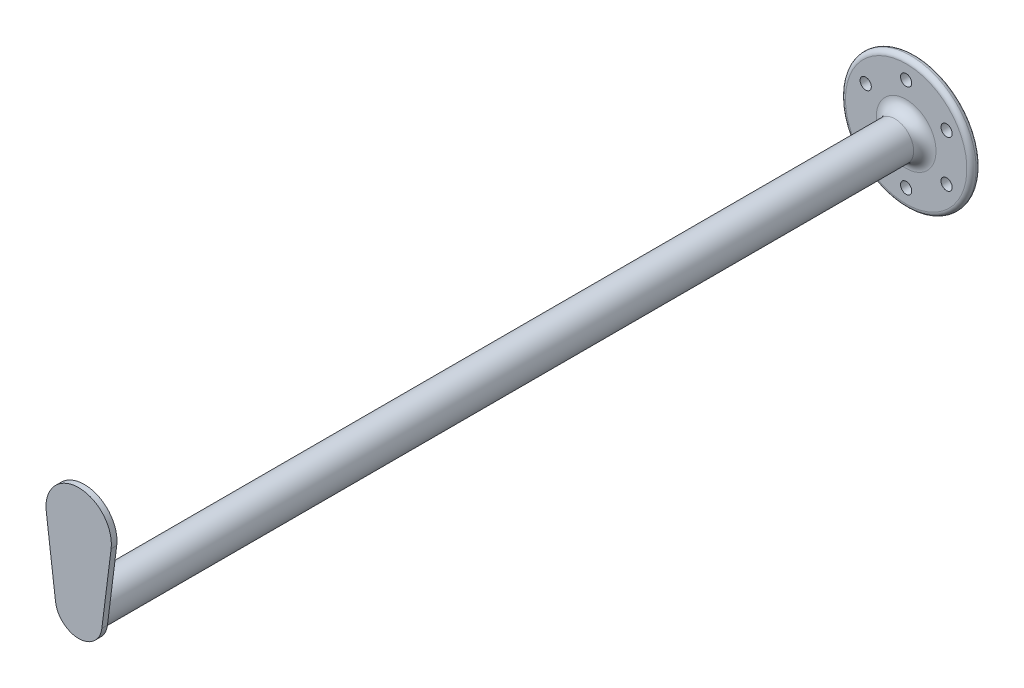
from build123d import *

# Parameters (mm, degrees)
SKETCH2_R           = 12.7
BOSS_EXTRUDE1_DEPTH = 558.8
SKETCH3_R           = 44.45
SKETCH3_R_2         = 3.81
BOSS_EXTRUDE2_DEPTH = 6.35
FILLET1_R           = 7.62
FILLET2_R           = 3.175
BOSS_EXTRUDE3_DEPTH = 3.81
FILLET3_R           = 1.27


with BuildPart() as part:
    # Sketch2 → Boss-Extrude1 (new body)
    with BuildSketch(Plane.XY):
        Circle(SKETCH2_R)
    extrude(amount=BOSS_EXTRUDE1_DEPTH)

    # Sketch3 → Boss-Extrude2 (add)
    with BuildSketch(Plane(origin=(0, 0, 0), x_dir=(-1, 0, 0), z_dir=(0, 0, -1))):
        Circle(SKETCH3_R)
        with Locations((0, 31.75)):
            Circle(SKETCH3_R_2, mode=Mode.SUBTRACT)
        with Locations((27.49630657, 15.875)):
            Circle(SKETCH3_R_2, mode=Mode.SUBTRACT)
        with Locations((27.49630657, -15.875)):
            Circle(SKETCH3_R_2, mode=Mode.SUBTRACT)
        with Locations((0, -31.75)):
            Circle(SKETCH3_R_2, mode=Mode.SUBTRACT)
        with Locations((-27.49630657, -15.875)):
            Circle(SKETCH3_R_2, mode=Mode.SUBTRACT)
        with Locations((-27.49630657, 15.875)):
            Circle(SKETCH3_R_2, mode=Mode.SUBTRACT)
    extrude(amount=BOSS_EXTRUDE2_DEPTH)

    # Fillet1
    fillet1_edges = [part.edges().sort_by_distance(p)[0] for p in [
        (-12.7, 0, 0),
    ]]
    fillet(fillet1_edges, radius=FILLET1_R)

    # Fillet2
    fillet2_edges = [part.edges().sort_by_distance(p)[0] for p in [
        (44.45, 0, -6.35),
        (44.45, 0, 0),
    ]]
    fillet(fillet2_edges, radius=FILLET2_R - 0.0001)  # a hair under: the kernel refuses the full size

    # Sketch4 → Boss-Extrude3 (add)
    with BuildSketch(Plane.XY.offset(558.8)):
        with BuildLine():
            Line((-15.750488274, -1.984375), (-22.050683583, 48.021875))
            ThreePointArc((-22.050683583, 48.021875), (0, 73.025), (22.050683583, 48.021875))
            Line((22.050683583, 48.021875), (15.750488274, -1.984375))
            ThreePointArc((15.750488274, -1.984375), (0, -15.875), (-15.750488274, -1.984375))
        make_face()
    extrude(amount=BOSS_EXTRUDE3_DEPTH)

    # Fillet3
    fillet3_edges = [part.edges().sort_by_distance(p)[0] for p in [
        (-12.7, 0, 558.8),
    ]]
    fillet(fillet3_edges, radius=FILLET3_R)


solid = part.part
